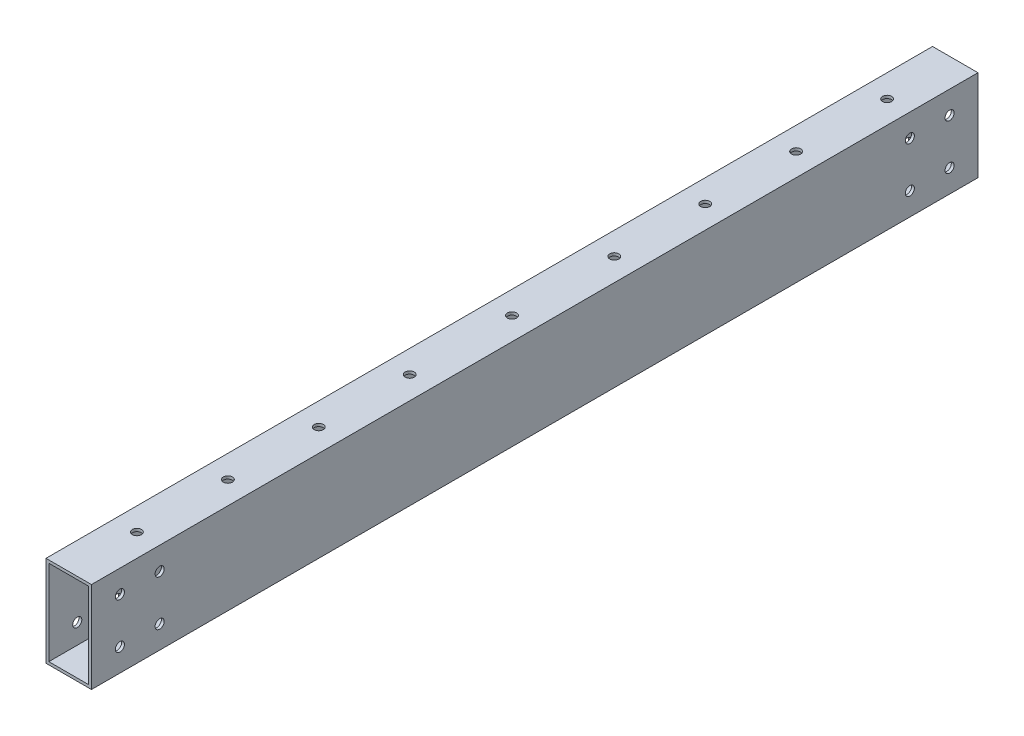
from build123d import *

# Parameters (mm, degrees)
SKETCH1_W           = 25.4
SKETCH1_H           = 50.8
SKETCH1_W_2         = 22.225
SKETCH1_H_2         = 47.625
BOSS_EXTRUDE1_DEPTH = 495.3
SKETCH2_R           = 2.54
CUT_EXTRUDE1_DEPTH  = 497.600855819
SKETCH3_R           = 2.54
CUT_EXTRUDE2_DEPTH  = 499.060257399


with BuildPart() as part:
    # Sketch1 → Boss-Extrude1 (new body)
    with BuildSketch(Plane.XY):
        Rectangle(SKETCH1_W, SKETCH1_H)
        Rectangle(SKETCH1_W_2, SKETCH1_H_2, mode=Mode.SUBTRACT)
    extrude(amount=BOSS_EXTRUDE1_DEPTH)

    # Sketch2 → Cut-Extrude1 (cut, through all)
    with BuildSketch(Plane(origin=(12.7, 0, 0), x_dir=(0, 0, -1), z_dir=(1, 0, 0))):
        with Locations((-479.425, -12.7)):
            Circle(SKETCH2_R)
        with Locations((-457.2, -12.7)):
            Circle(SKETCH2_R)
        with Locations((-479.425, 12.7)):
            Circle(SKETCH2_R)
        with Locations((-457.2, 12.7)):
            Circle(SKETCH2_R)
        with Locations((-38.1, 12.7)):
            Circle(SKETCH2_R)
        with Locations((-15.875, 12.7)):
            Circle(SKETCH2_R)
        with Locations((-38.1, -12.7)):
            Circle(SKETCH2_R)
        with Locations((-15.875, -12.7)):
            Circle(SKETCH2_R)
    extrude(amount=-CUT_EXTRUDE1_DEPTH, mode=Mode.SUBTRACT)

    # Sketch3 → Cut-Extrude2 (cut, through all)
    with BuildSketch(Plane(origin=(0, 25.4, 0), x_dir=(1, 0, 0), z_dir=(0, 1, 0))):
        with Locations((0, -457.2)):
            Circle(SKETCH3_R)
        with Locations((0, -406.4)):
            Circle(SKETCH3_R)
        with Locations((0, -355.6)):
            Circle(SKETCH3_R)
        with Locations((0, -304.8)):
            Circle(SKETCH3_R)
        with Locations((0, -190.5)):
            Circle(SKETCH3_R)
        with Locations((0, -139.7)):
            Circle(SKETCH3_R)
        with Locations((0, -88.9)):
            Circle(SKETCH3_R)
        with Locations((0, -38.1)):
            Circle(SKETCH3_R)
        with Locations((0, -247.65)):
            Circle(SKETCH3_R)
    extrude(amount=-CUT_EXTRUDE2_DEPTH, mode=Mode.SUBTRACT)


solid = part.part
